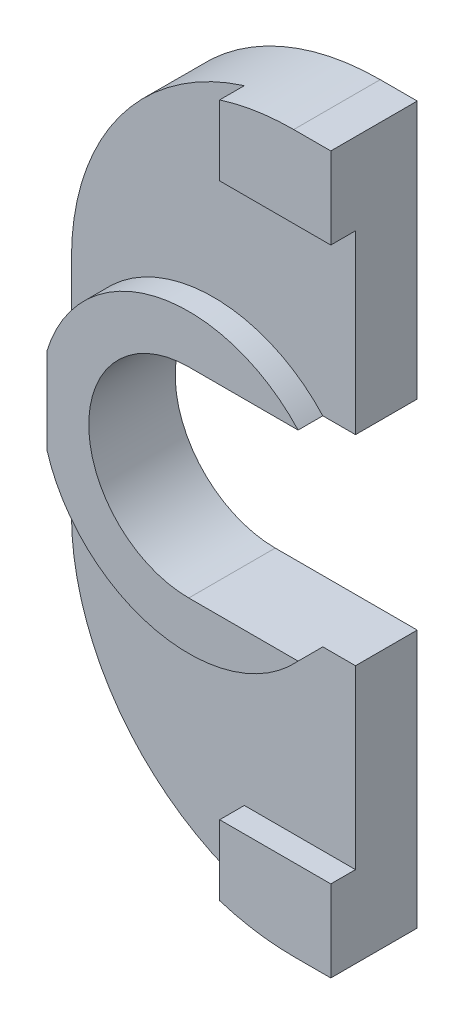
from build123d import *

# Parameters (mm, degrees)
BOSS_EXTRUDE1_DEPTH = 2.5
BOSS_EXTRUDE2_DEPTH = 1
BOSS_EXTRUDE3_DEPTH = 1


with BuildPart() as part:
    # Sketch2 → Boss-Extrude1 (new body)
    with BuildSketch(Plane.XY):
        with BuildLine():
            Line((0, 4.05), (5.75, 4.05))
            Line((5.75, 4.05), (5.75, 14.5))
            Line((5.75, 14.5), (4.25, 14.5))
            ThreePointArc((4.25, 14.5), (-2.821067812, 11.571067812), (-5.75, 4.5))
            Line((-5.75, 4.5), (-5.75, -4.5))
            ThreePointArc((-5.75, -4.5), (-2.821067812, -11.571067812), (4.25, -14.5))
            Line((4.25, -14.5), (5.75, -14.5))
            Line((5.75, -14.5), (5.75, -4.05))
            Line((5.75, -4.05), (0, -4.05))
            ThreePointArc((0, -4.05), (-4.05, 0), (0, 4.05))
        make_face()
    extrude(amount=BOSS_EXTRUDE1_DEPTH)

    # Sketch3 → Boss-Extrude2 (add)
    with BuildSketch(Plane.XY.offset(2.5)):
        with BuildLine():
            Line((0, 4.05), (4.426906369, 4.05))
            ThreePointArc((4.426906369, 4.05), (-1.342374407, 5.847908254), (-5.75, 1.71391365))
            Line((-5.75, 1.71391365), (-5.75, -1.71391365))
            ThreePointArc((-5.75, -1.71391365), (-1.342374407, -5.847908254), (4.426906369, -4.05))
            Line((4.426906369, -4.05), (0, -4.05))
            ThreePointArc((0, -4.05), (-4.05, 0), (0, 4.05))
        make_face()
    extrude(amount=BOSS_EXTRUDE2_DEPTH)

    # Sketch4 → Boss-Extrude3 (add)
    with BuildSketch(Plane.XY.offset(2.5)):
        with BuildLine():
            Line((1.25, 11.2), (5.75, 11.2))
            Line((5.75, 11.2), (5.75, 14.5))
            Line((5.75, 14.5), (4.25, 14.5))
            ThreePointArc((4.25, 14.5), (2.732423007, 14.384177258), (1.25, 14.039392014))
            Line((1.25, 14.039392014), (1.25, 11.2))
        make_face()
    boss_extrude3 = extrude(amount=BOSS_EXTRUDE3_DEPTH)

    # Mirror1: Boss-Extrude3 across plane
    add(boss_extrude3.mirror(Plane.ZX))


solid = part.part
